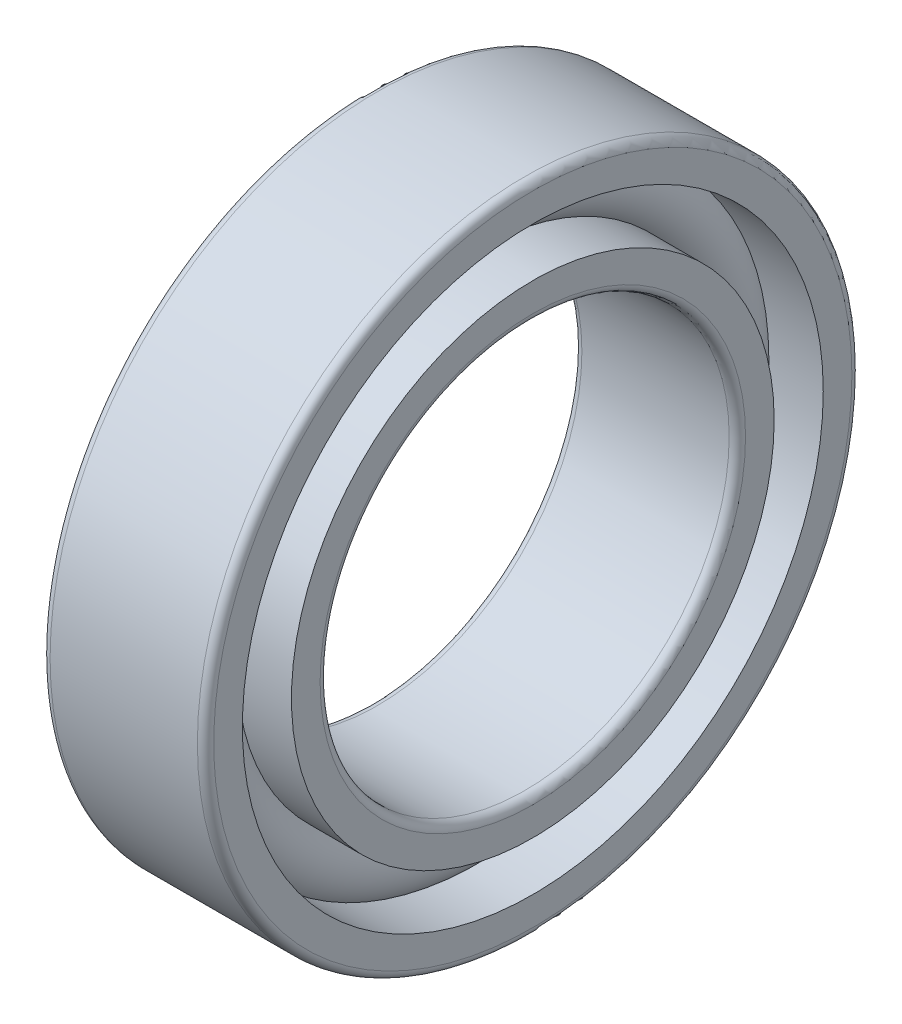
from build123d import *

# Parameters (mm, degrees)
CAGSPISKE_W     = 0.27
CAGSPISKE_H     = 0.45
CAGESPINE_ANGLE = 0.001
BALSIMSKE_R     = 1.35


with BuildPart() as part:
    # CagSpiSke → CageSpine (revolve)
    with BuildSketch(Plane.XY):
        with Locations((0, 9.75)):
            Rectangle(CAGSPISKE_W, CAGSPISKE_H)
    revolve(axis=Axis((-20.6375, 0, 0), (-1, 0, 0)), revolution_arc=CAGESPINE_ANGLE)

    # BalSimSke → BallsSimplified (revolve)
    with BuildSketch(Plane.XY):
        with Locations((0, 9.75)):
            Circle(BALSIMSKE_R)
    revolve(axis=Axis((-10, 0, 0), (1, 0, 0)))

    # InnRacSke → InnerRace (revolve)
    with BuildSketch(Plane.XY):
        with BuildLine():
            Line((-0.972432517, 8.85), (-3, 8.85))
            Line((-3, 8.85), (-3, 7.8))
            ThreePointArc((-3, 7.8), (-2.912132034, 7.587867966), (-2.7, 7.5))
            Line((-2.7, 7.5), (2.7, 7.5))
            ThreePointArc((2.7, 7.5), (2.912132034, 7.587867966), (3, 7.8))
            Line((3, 7.8), (3, 8.85))
            Line((3, 8.85), (0.972432517, 8.85))
            ThreePointArc((0.972432517, 8.85), (0, 8.425), (-0.972432517, 8.85))
        make_face()
    revolve(axis=Axis((-20.6375, 0, 0), (1, 0, 0)))

    # OutRacSke → OuterRace (revolve)
    with BuildSketch(Plane.XY):
        with BuildLine():
            Line((-0.972432517, 10.65), (-3, 10.65))
            Line((-3, 10.65), (-3, 11.7))
            ThreePointArc((-3, 11.7), (-2.912132034, 11.912132034), (-2.7, 12))
            Line((-2.7, 12), (2.7, 12))
            ThreePointArc((2.7, 12), (2.912132034, 11.912132034), (3, 11.7))
            Line((3, 11.7), (3, 10.65))
            Line((3, 10.65), (0.972432517, 10.65))
            ThreePointArc((0.972432517, 10.65), (0, 11.075), (-0.972432517, 10.65))
        make_face()
    revolve(axis=Axis((-20.6375, 0, 0), (1, 0, 0)))


solid = part.part
